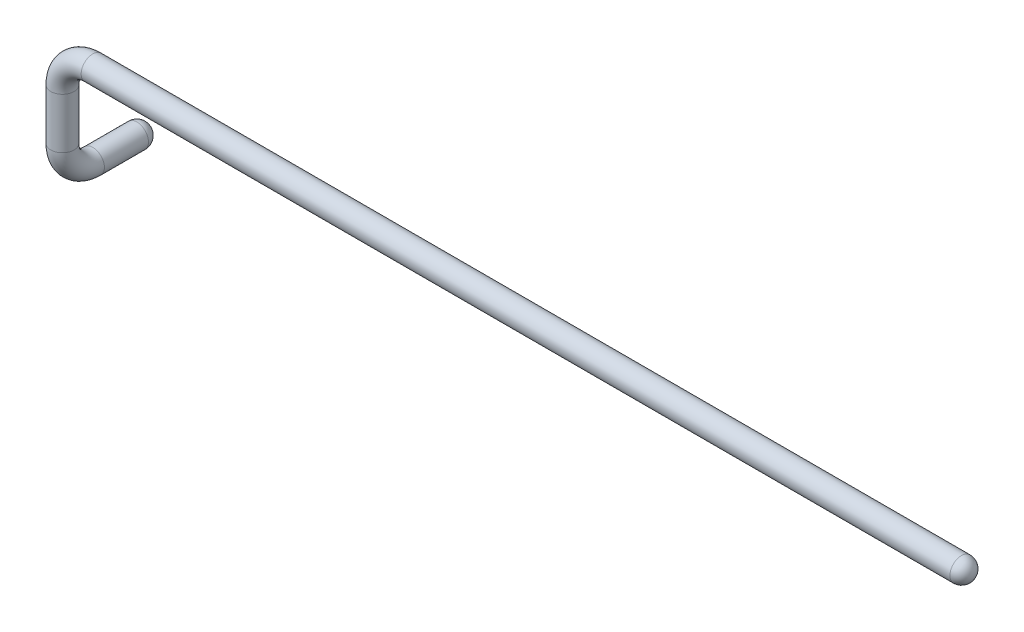
from build123d import *

# Parameters (mm, degrees)
SKICA4_R                       = 0.575
T_HNOUT_PO_K_IVCE2_OUTLINE_R   = 0.575
T_HNOUT_PO_K_IVCE2_ANGLE       = 90
T_HNOUT_START                  = -0.2500001
T_HNOUT_PO_K_IVCE2_2_OUTLINE_R = 0.575
T_HNOUT_PO_K_IVCE2_2_DEPTH     = 2.5000002
T_HNOUT_START_2                = -4.25
T_HNOUT_PO_K_IVCE2_3_OUTLINE_R = 0.575
T_HNOUT_PO_K_IVCE2_3_DEPTH     = 2.7500001
ZAOBLIT1_R                     = 0.575


with BuildPart() as part:
    # Táhnout po křivce1: sweep along a path in Skica1
    with BuildLine(Plane.XY) as t_hnout_po_k_ivce1_path:
        Line((0, 0), (0, 2.25))
        ThreePointArc((0, 2.25), (0.439339828, 3.310660172), (1.5, 3.75))
        Line((1.5, 3.75), (45, 3.75))
    # Skica4 → Táhnout po křivce1 (sweep)
    with BuildSketch(Plane(origin=(45, 0, 0), x_dir=(0, 0, -1), z_dir=(1, 0, 0))):
        with Locations((0, 3.75)):
            Circle(SKICA4_R)
    sweep(path=t_hnout_po_k_ivce1_path.line)



with BuildPart() as body_2:
    # Táhnout po křivce2: read off the stored shape, not the designer's step
    # Táhnout po křivce2 outline → Táhnout po křivce2 (revolve)
    with BuildSketch(Plane(origin=(0, -0.25, -1.5), x_dir=(0, 0, 1), z_dir=(0, 1, 0))):
        with Locations((1.5, 0)):
            Circle(T_HNOUT_PO_K_IVCE2_OUTLINE_R)
    revolve(axis=Axis((0, -0.25, -1.5), (1, 0, 0)), revolution_arc=T_HNOUT_PO_K_IVCE2_ANGLE)


with BuildPart() as part_1:
    add(part.part)

    add(body_2.part)  # T_hnout po k_ivce2 2 merges body 2
    # T_hnout po k_ivce2 2 outline → T_hnout po k_ivce2 2 (add)
    with BuildSketch(Plane(origin=(0, 0, 0), x_dir=(1, 0, 0), z_dir=(0, 1, 0)).offset(T_HNOUT_START)):
        Circle(T_HNOUT_PO_K_IVCE2_2_OUTLINE_R)
    extrude(amount=T_HNOUT_PO_K_IVCE2_2_DEPTH)

    # T_hnout po k_ivce2 3 outline → T_hnout po k_ivce2 3 (add)
    with BuildSketch(Plane.XY.offset(T_HNOUT_START_2)):
        with Locations((0, -1.75)):
            Circle(T_HNOUT_PO_K_IVCE2_3_OUTLINE_R)
    extrude(amount=T_HNOUT_PO_K_IVCE2_3_DEPTH)

    # Zaoblit1
    zaoblit1_edges = [part_1.edges().sort_by_distance(p)[0] for p in [
        (45, 3.75, 0.575),
        (-0.575, -1.75, -4.25),
    ]]
    fillet(zaoblit1_edges, radius=ZAOBLIT1_R)


solid = part_1.part
